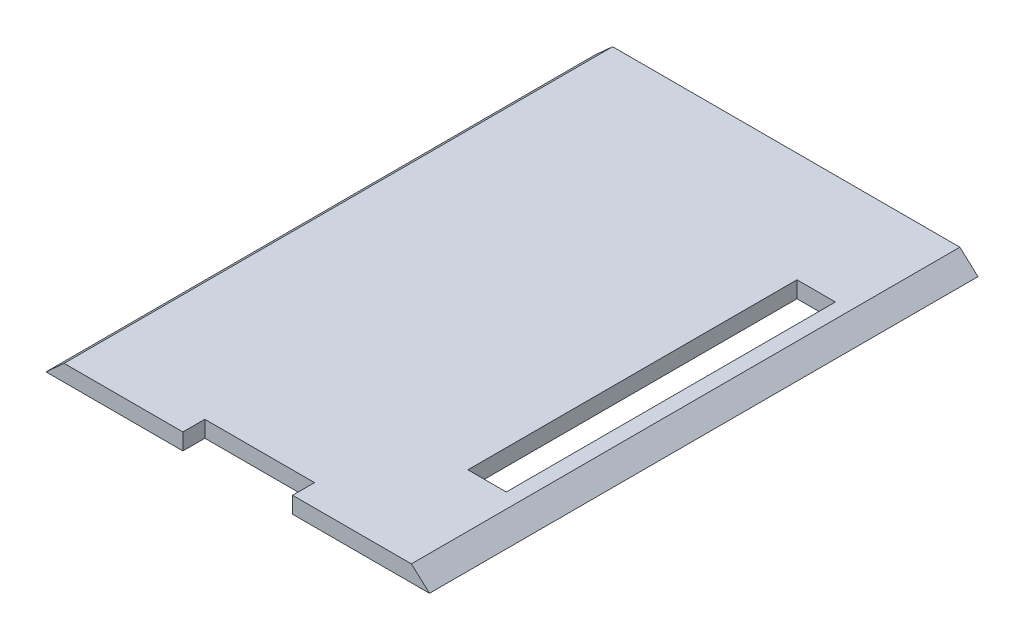
from build123d import *

# Parameters (mm, degrees)
BOSS_EXTRUDE1_DEPTH = 127
SKETCH3_W           = 25.4
SKETCH3_H           = 5.08
CUT_EXTRUDE1_DEPTH  = 135.591199998
SKETCH5_W           = 8.89
SKETCH5_H           = 76.2
CUT_EXTRUDE3_DEPTH  = 135.591199998


with BuildPart() as part:
    # Sketch1 → Boss-Extrude1 (new body)
    with BuildSketch(Plane.XY):
        Polygon((-40.203883769, 5.937788296), (40.203883769, 5.937788296), (44.399042974, 2.127788296), (-44.399042974, 2.127788296), align=None)
    extrude(amount=BOSS_EXTRUDE1_DEPTH)

    # Sketch3 → Cut-Extrude1 (cut, through all)
    with BuildSketch(Plane.XZ.offset(-2.127788296)):
        with Locations((0, 124.46)):
            Rectangle(SKETCH3_W, SKETCH3_H)
    extrude(amount=-CUT_EXTRUDE1_DEPTH, mode=Mode.SUBTRACT)

    # Sketch5 → Cut-Extrude3 (cut, through all)
    with BuildSketch(Plane.XZ.offset(-2.127788296)):
        with Locations((32.334042974, 63.5)):
            Rectangle(SKETCH5_W, SKETCH5_H)
    extrude(amount=-CUT_EXTRUDE3_DEPTH, mode=Mode.SUBTRACT)


solid = part.part
